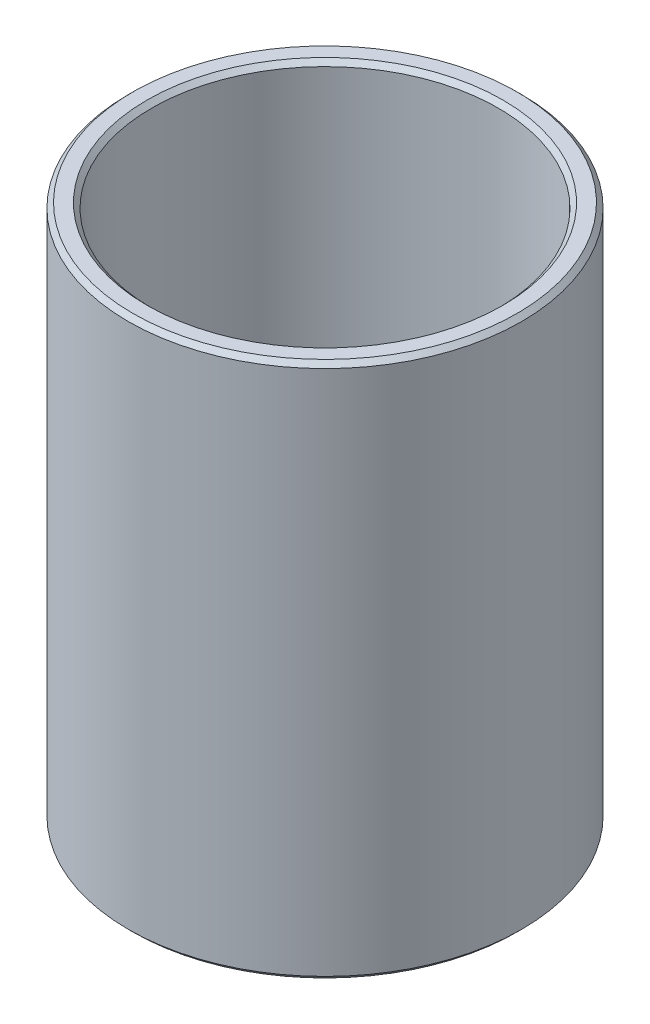
from build123d import *

# Parameters (mm, degrees)
SKETCH1_R           = 52.5
BOSS_EXTRUDE1_DEPTH = 143.027386134
SKETCH2_R           = 46.256907555
CUT_EXTRUDE1_DEPTH  = 162.15003315
CHAMFER1_SIZE       = 1.242183232


with BuildPart() as part:
    # Sketch1 → Boss-Extrude1 (new body)
    with BuildSketch(Plane(origin=(0, 0, 0), x_dir=(1, 0, 0), z_dir=(0, 1, 0))):
        Circle(SKETCH1_R)
    extrude(amount=BOSS_EXTRUDE1_DEPTH)

    # Sketch2 → Cut-Extrude1 (cut, through all)
    with BuildSketch(Plane(origin=(0, 0, 0), x_dir=(1, 0, 0), z_dir=(0, 1, 0))):
        Circle(SKETCH2_R)
    extrude(amount=CUT_EXTRUDE1_DEPTH, mode=Mode.SUBTRACT)

    # Chamfer1
    chamfer1_edges = [part.edges().sort_by_distance(p)[0] for p in [
        (-46.256907555, 143.027386134, 0),
        (-46.256907555, 0, 0),
        (-52.5, 0, 0),
        (-52.5, 143.027386134, 0),
    ]]
    chamfer(chamfer1_edges, length=CHAMFER1_SIZE)


solid = part.part
